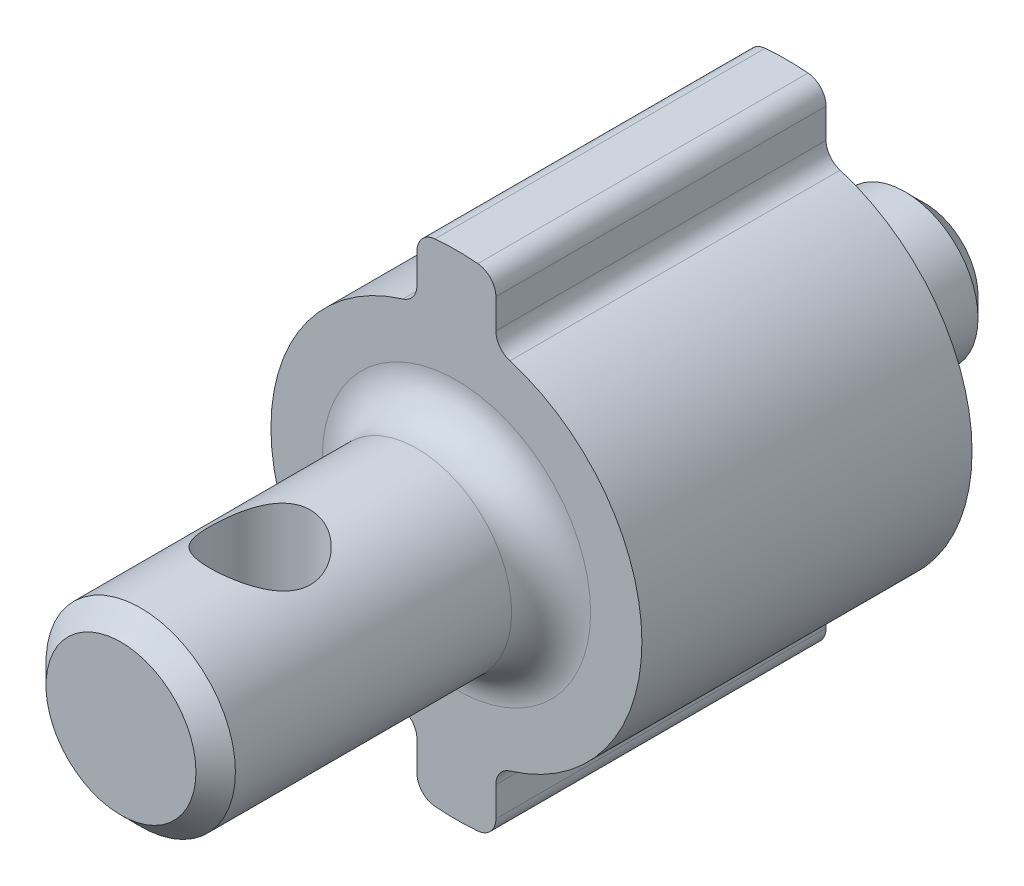
from build123d import *

# Parameters (mm, degrees)
SKETCH1_R               = 4.7
BOSS_EXTRUDE1_DEPTH     = 11.866666667
SKETCH2_OUTSIDE_W       = 14.964
SKETCH2_OUTSIDE_H       = 14.964
SKETCH2_OUTSIDE_R       = 1.85
CUT_EXTRUDE1_DEPTH      = 3.5
BOSS_EXTRUDE2_START     = -8.366666667
BOSS_EXTRUDE2_DEPTH     = 8.366666667
FILLET1_R               = 0.5
FILLET2_R               = 0.5
SKETCH4_R               = 2.4
BOSS_EXTRUDE3_DEPTH     = 8.5
FILLET3_R               = 1
CHAMFER1_SIZE           = 0.5
CUT_EXTRUDE2_DEPTH      = 22.816361088
CUT_EXTRUDE2_DEPTH_BACK = 22.816361088
SKETCH5_R               = 1.275


with BuildPart() as part:
    # Sketch1 → Boss-Extrude1 (new body)
    with BuildSketch(Plane.XY):
        Circle(SKETCH1_R)
    extrude(amount=BOSS_EXTRUDE1_DEPTH)

    # Sketch2 outside → Cut-Extrude1 (cut)
    with BuildSketch(Plane(origin=(0, 0, 0), x_dir=(-1, 0, 0), z_dir=(0, 0, -1))):
        Rectangle(SKETCH2_OUTSIDE_W, SKETCH2_OUTSIDE_H)
        Circle(SKETCH2_OUTSIDE_R, mode=Mode.SUBTRACT)
    extrude(amount=-CUT_EXTRUDE1_DEPTH, mode=Mode.SUBTRACT)

    # Sketch3 → Boss-Extrude2 (add)
    with BuildSketch(Plane.XY.offset(11.866666667).offset(BOSS_EXTRUDE2_START)):
        with BuildLine():
            Line((-1, 6.16948134), (-1, 4.592385001))
            ThreePointArc((-1, 4.592385001), (0, 4.7), (1, 4.592385001))
            Line((1, 4.592385001), (1, 6.16948134))
            ThreePointArc((1, 6.16948134), (0, 6.25), (-1, 6.16948134))
        make_face()
        with BuildLine():
            ThreePointArc((1, -4.592385001), (0, -4.7), (-1, -4.592385001))
            Line((-1, -4.592385001), (-1, -6.16948134))
            ThreePointArc((-1, -6.16948134), (0, -6.25), (1, -6.16948134))
            Line((1, -6.16948134), (1, -4.592385001))
        make_face()
    extrude(amount=BOSS_EXTRUDE2_DEPTH)

    # Fillet1
    fillet1_edges = [part.edges().sort_by_distance(p)[0] for p in [
        (-1, 6.16948134, 7.683333333),
        (-1, 4.592385001, 7.683333333),
        (1, 4.592385001, 7.683333333),
        (1, 6.16948134, 7.683333333),
        (1, -6.16948134, 7.683333333),
        (1, -4.592385001, 7.683333333),
        (-1, -4.592385001, 7.683333333),
        (-1, -6.16948134, 7.683333333),
    ]]
    fillet(fillet1_edges, radius=FILLET1_R)

    # Fillet2
    fillet2_edges = [part.edges().sort_by_distance(p)[0] for p in [
        (1.85, 0, 3.5),
    ]]
    fillet(fillet2_edges, radius=FILLET2_R)

    # Sketch4 → Boss-Extrude3 (add)
    with BuildSketch(Plane.XY.offset(11.866666667)):
        Circle(SKETCH4_R)
    extrude(amount=BOSS_EXTRUDE3_DEPTH)

    # Fillet3
    fillet3_edges = [part.edges().sort_by_distance(p)[0] for p in [
        (-2.4, 0, 11.866666667),
    ]]
    fillet(fillet3_edges, radius=FILLET3_R)

    # Chamfer1
    chamfer1_edges = [part.edges().sort_by_distance(p)[0] for p in [
        (1.85, 0, 0),
        (-2.4, 0, 20.366666667),
    ]]
    chamfer(chamfer1_edges, length=CHAMFER1_SIZE)

    # Sketch5 → Cut-Extrude2 (cut, two sides: drawn at the far end of the back side and taken through both)
    with BuildSketch(Plane(origin=(0, 0, 0), x_dir=(1, 0, 0), z_dir=(0, 1, 0)).offset(-CUT_EXTRUDE2_DEPTH_BACK)):
        with Locations(Location((0, -16.841666667, 0), (0, 0, 270))):
            Circle(SKETCH5_R)
    extrude(amount=CUT_EXTRUDE2_DEPTH + CUT_EXTRUDE2_DEPTH_BACK, mode=Mode.SUBTRACT)


solid = part.part
